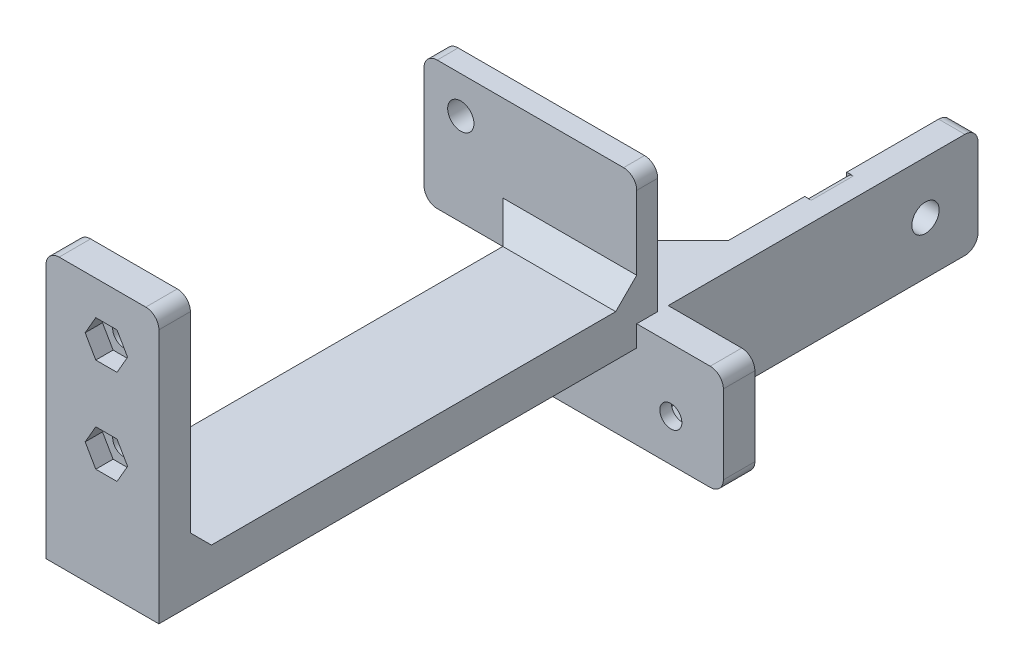
from build123d import *

# Parameters (mm, degrees)
SKETCH_3_W          = 38
SKETCH_3_H          = 20
EXTRUDE_1_DEPTH     = 6
SKETCH_4_W          = 5
SKETCH_4_H          = 20
EXTRUDE_2_DEPTH     = 59
SKETCH_9_W          = 40.5
SKETCH_9_H          = 24.5
EXTRUDE_4_DEPTH     = 4
SKETCH_12_W         = 21.5
SKETCH_12_H         = 85
EXTRUDE_5_DEPTH     = 4
SKETCH_13_W         = 21.5
SKETCH_13_H         = 51
EXTRUDE_6_DEPTH     = 6
EXTRUDE_8_DEPTH     = 4
CUT_EXTRUDE_START   = -20
CUT_EXTRUDE_7_DEPTH = 8
SKETCH_5_R          = 2.1
CUT_EXTRUDE_1_DEPTH = 114.903467902
CUT_EXTRUDE_2_DEPTH = 3.8
SKETCH_7_R          = 2.6
CUT_EXTRUDE_3_DEPTH = 120.57529009
SKETCH_17_R         = 2.1
CUT_EXTRUDE_4_DEPTH = 165.903001792
CUT_EXTRUDE_5_DEPTH = 3.3
SKETCH_19_R         = 2.5
CUT_EXTRUDE_6_DEPTH = 118.123866056
FILLET_2_R          = 2.5
CHAMFER_2_SIZE      = 4


with BuildPart() as part:
    # Эскиз3 → Бобышка-Вытянуть1 (new body)
    with BuildSketch(Plane.XY):
        Rectangle(SKETCH_3_W, SKETCH_3_H)
    extrude(amount=EXTRUDE_1_DEPTH)

    # Эскиз4 → Бобышка-Вытянуть2 (add)
    with BuildSketch(Plane(origin=(-10.8, 0, 0), x_dir=(1, 0, 0), z_dir=(0, 0, 1))):
        with Locations((10.8, 0)):
            Rectangle(SKETCH_4_W, SKETCH_4_H)
    extrude(amount=-EXTRUDE_2_DEPTH)

    # Эскиз9 → Бобышка-Вытянуть4 (add)
    with BuildSketch(Plane.XY.offset(6)):
        with Locations((-17.75, 22.25)):
            Rectangle(SKETCH_9_W, SKETCH_9_H)
    extrude(amount=-EXTRUDE_4_DEPTH)

    # Эскиз12 → Бобышка-Вытянуть5 (add, symmetric)
    with BuildSketch(Plane(origin=(0, 10, 0), x_dir=(-1, 0, 0), z_dir=(0, 1, 0))):
        with Locations((8.25, 48.5)):
            Rectangle(SKETCH_12_W, SKETCH_12_H)
    extrude(amount=EXTRUDE_5_DEPTH, both=True)

    # Эскиз13 → Бобышка-Вытянуть6 (add)
    with BuildSketch(Plane.XY.offset(91)):
        with Locations((-8.25, 31.5)):
            Rectangle(SKETCH_13_W, SKETCH_13_H)
    extrude(amount=EXTRUDE_6_DEPTH)

    # Эскиз23 → Бобышка-Вытянуть8 (add)
    with BuildSketch(Plane(origin=(0, 10, 0), x_dir=(1, 0, 0), z_dir=(0, 1, 0))):
        Polygon((-2.5, 16.5), (-19, 0), (-2.5, 0), align=None)
    extrude(amount=-EXTRUDE_8_DEPTH)

    # Эскиз21 → Вырез-Вытянуть7 (cut)
    with BuildSketch(Plane(origin=(0, 0, -59), x_dir=(-1, 0, 0), z_dir=(0, 0, -1)).offset(CUT_EXTRUDE_START)):
        with BuildLine():
            Line((1.25, 10), (2.5, 10))
            Line((2.5, 10), (2.5, 8.75))
            ThreePointArc((2.5, 8.75), (2.133883476, 9.633883476), (1.25, 10))
        make_face()
    extrude(amount=-CUT_EXTRUDE_7_DEPTH, mode=Mode.SUBTRACT)

    # Эскиз5 → Вырез-Вытянуть1 (cut, through all)
    with BuildSketch(Plane.XY.offset(6)):
        with Locations((-9, -2)):
            Circle(SKETCH_5_R)
        with Locations((9, -2)):
            Circle(SKETCH_5_R)
    extrude(amount=-CUT_EXTRUDE_1_DEPTH, mode=Mode.SUBTRACT)

    # Эскиз6 → Вырез-Вытянуть2 (cut)
    with BuildSketch(Plane(origin=(0, 0, 0), x_dir=(-1, 0, 0), z_dir=(0, 0, -1))):
        Polygon((-9, 2.156921938), (-12.6, 0.078460969), (-12.6, -4.078460969), (-9, -6.156921938), (-5.4, -4.078460969), (-5.4, 0.078460969), align=None)
        Polygon((9, 2.156921938), (5.4, 0.078460969), (5.4, -4.078460969), (9, -6.156921938), (12.6, -4.078460969), (12.6, 0.078460969), align=None)
    extrude(amount=-CUT_EXTRUDE_2_DEPTH, mode=Mode.SUBTRACT)

    # Эскиз7 → Вырез-Вытянуть3 (cut, through all)
    with BuildSketch(Plane(origin=(2.5, 0, 0), x_dir=(0, 0, -1), z_dir=(1, 0, 0))):
        with Locations((49, 0)):
            Circle(SKETCH_7_R)
    extrude(amount=-CUT_EXTRUDE_3_DEPTH, mode=Mode.SUBTRACT)

    # Эскиз17 → Вырез-Вытянуть4 (cut, through all)
    with BuildSketch(Plane(origin=(0, 0, 91), x_dir=(-1, 0, 0), z_dir=(0, 0, -1))):
        with Locations((7.5, 29)):
            Circle(SKETCH_17_R)
        with Locations((7.5, 47)):
            Circle(SKETCH_17_R)
    extrude(amount=-CUT_EXTRUDE_4_DEPTH, mode=Mode.SUBTRACT)

    # Эскиз18 → Вырез-Вытянуть5 (cut)
    with BuildSketch(Plane.XY.offset(97)):
        Polygon((-3.458548116, 29), (-5.479274058, 32.5), (-9.520725942, 32.5), (-11.541451884, 29), (-9.520725942, 25.5), (-5.479274058, 25.5), align=None)
        Polygon((-3.458548116, 47), (-5.479274058, 50.5), (-9.520725942, 50.5), (-11.541451884, 47), (-9.520725942, 43.5), (-5.479274058, 43.5), align=None)
    extrude(amount=-CUT_EXTRUDE_5_DEPTH, mode=Mode.SUBTRACT)

    # Эскиз19 → Вырез-Вытянуть6 (cut, through all)
    with BuildSketch(Plane(origin=(0, 0, 2), x_dir=(-1, 0, 0), z_dir=(0, 0, -1))):
        with Locations((30.999999999, 27.499999999)):
            Circle(SKETCH_19_R)
    extrude(amount=-CUT_EXTRUDE_6_DEPTH, mode=Mode.SUBTRACT)

    # Скругление2
    fillet_2_edges = [part.edges().sort_by_distance(p)[0] for p in [
        (-19, 57, 94),
        (2.5, 57, 94),
        (19, 10, 3),
        (19, -10, 3),
        (-19, -10, 3),
        (-38, 34.5, 4),
        (-38, 10, 4),
        (2.5, 34.5, 4),
        (0, -10, -59),
        (0, 10, -59),
    ]]
    fillet(fillet_2_edges, radius=FILLET_2_R)

    # Фаска2
    chamfer_2_edges = [part.edges().sort_by_distance(p)[0] for p in [
        (-8.25, 14, 91),
        (-19, 12, 6),
        (-8.25, 14, 6),
    ]]
    chamfer(chamfer_2_edges, length=CHAMFER_2_SIZE)


solid = part.part
